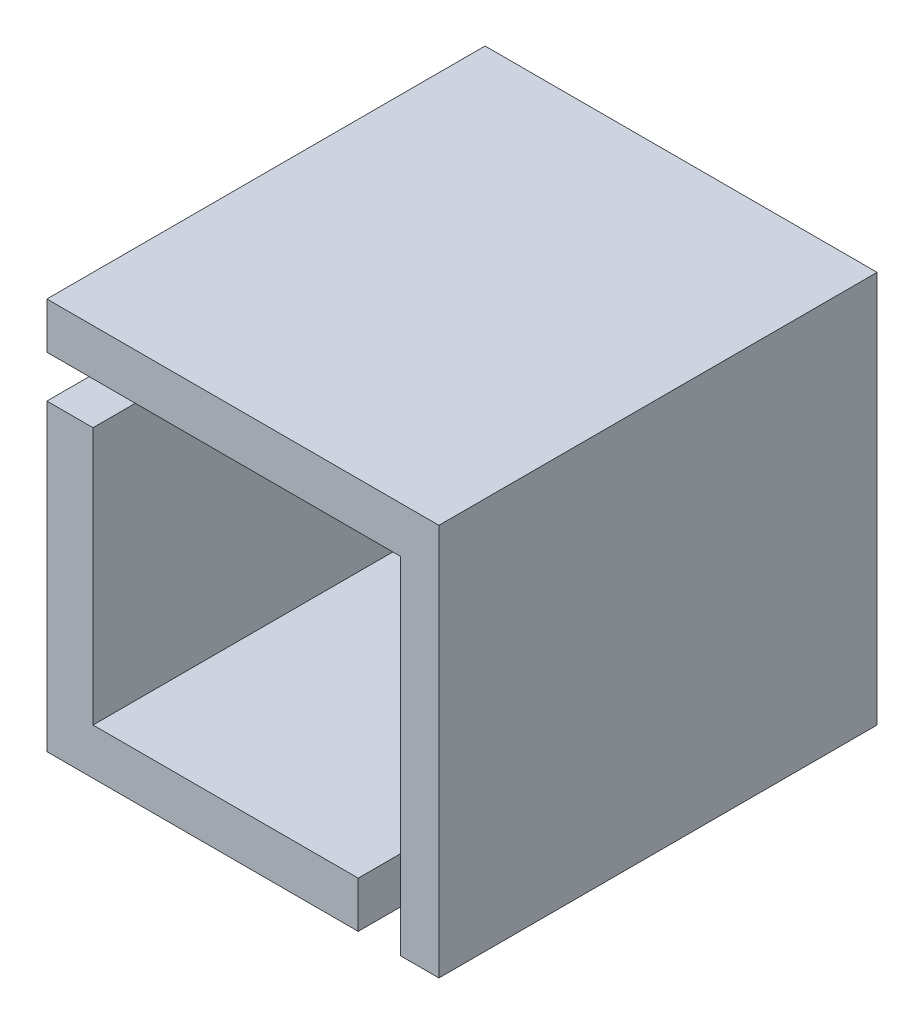
from build123d import *

# Parameters (mm, degrees)
SKETCH1_W           = 25.5
SKETCH1_H           = 25.5
BOSS_EXTRUDE5_DEPTH = 3
BOSS_EXTRUDE6_DEPTH = 25.5


with BuildPart() as part:
    # Sketch1 → Boss-Extrude5 (new body)
    with BuildSketch(Plane.XY):
        with Locations((-18.990064731, -2.49830583)):
            Rectangle(SKETCH1_W, SKETCH1_H)
    extrude(amount=BOSS_EXTRUDE5_DEPTH)

    # Sketch2 → Boss-Extrude6 (add)
    with BuildSketch(Plane.XY.offset(3)):
        Polygon((-31.740064731, 10.25169417), (-6.240064731, 10.25169417), (-6.240064731, -15.24830583), (-8.740064731, -15.24830583), (-8.740064731, 7.25169417), (-31.740064731, 7.25169417), align=None)
        Polygon((-31.740064731, 4.50169417), (-28.740064731, 4.50169417), (-28.740064731, -12.24830583), (-11.490064731, -12.24830583), (-11.490064731, -15.24830583), (-31.740064731, -15.24830583), align=None)
    extrude(amount=BOSS_EXTRUDE6_DEPTH)


solid = part.part
